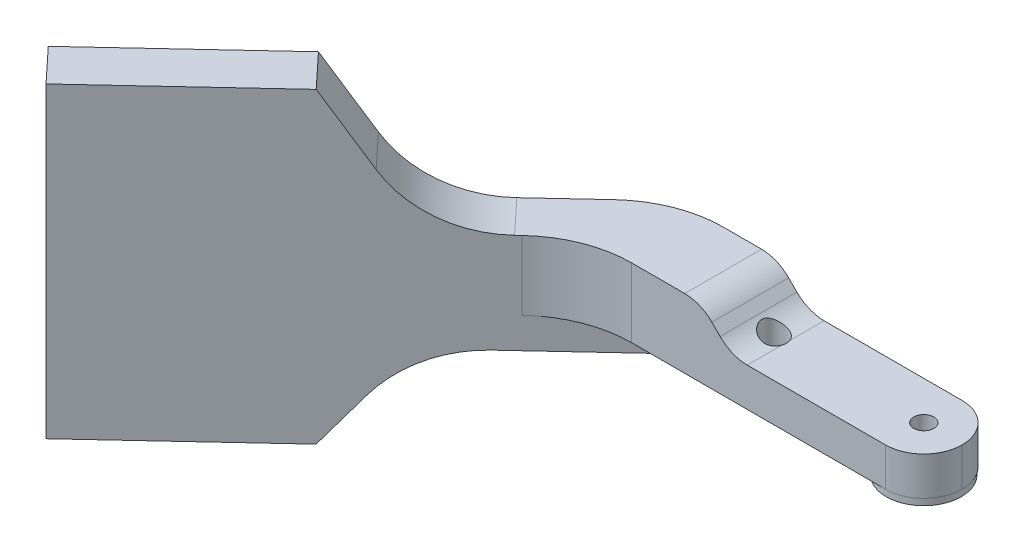
from build123d import *

# Parameters (mm, degrees)
BOSS_EXTRUDE1_DEPTH = 5
FILLET1_R           = 5
SKETCH2_R           = 1.2999999999999945
CUT_EXTRUDE1_DEPTH  = 10
BOSS_EXTRUDE2_DEPTH = 20
BOSS_EXTRUDE3_DEPTH = 15
BOSS_EXTRUDE4_DEPTH = 6
SKETCH6_R           = 4.900000000000002
SKETCH6_R_2         = 1.299999999999994
BOSS_EXTRUDE5_DEPTH = 0.9
BOSS_EXTRUDE6_DEPTH = 3.9999999999999964
BOSS_EXTRUDE7_DEPTH = 3.9999999999999964
FILLET2_R           = 15
FILLET7_SIZE        = 5
FILLET8_R           = 5
SKETCH10_R          = 1.6000000000000019
CUT_EXTRUDE2_DEPTH  = 10


# Some blends are built 0.0001 mm under size
with BuildPart() as part:
    # Sketch1 → Boss-Extrude1 (new body)
    with BuildSketch(Plane(origin=(0, 0, 0), x_dir=(1, 0, 0), z_dir=(0, 1, 0))):
        Polygon((4.091990160374978, 5.611877790284978), (0, 10), (0, 1.79603523340848), align=None)
        Polygon((0, 1.79603523340848), (0, 10), (-42.4185146939121, -29.55590488362469), (-38.32652453353713, -33.94402709333974), (-1.9260119864091507, 0), align=None)
        Polygon((42, 10), (0, 10), (4.091990160374978, 5.611877790284978), (0, 1.7960352334084817), (0, 0), (42, 0), align=None)
        Polygon((0, 0), (0, 1.79603523340848), (-1.9260119864091507, 0), align=None)
    extrude(amount=BOSS_EXTRUDE1_DEPTH)

    # Fillet1
    fillet1_edges = [part.edges().sort_by_distance(p)[0] for p in [
        (42, 2.5, 0),
        (42, 2.5, -10),
    ]]
    fillet(fillet1_edges, radius=FILLET1_R - 0.0001)  # a hair under: the kernel refuses the full size

    # Sketch2 → Cut-Extrude1 (cut)
    with BuildSketch(Plane(origin=(0, 5, 0), x_dir=(1, 0, 0), z_dir=(0, 1, 0))):
        with Locations(Location((37.00000000000001, 4.999999999999989, 0), (0, 0, 270))):
            Circle(SKETCH2_R)
    extrude(amount=-CUT_EXTRUDE1_DEPTH, mode=Mode.SUBTRACT)

    # Sketch3 → Boss-Extrude2 (add)
    with BuildSketch(Plane(origin=(0, 5, 0), x_dir=(1, 0, 0), z_dir=(0, 1, 0))):
        Polygon((-42.4185146939121, -29.55590488362471), (-38.32652453353713, -33.94402709333974), (-20.126268259973138, -16.97201354666987), (-24.21825842034811, -12.583891336954824), align=None)
    extrude(amount=BOSS_EXTRUDE2_DEPTH)

    # Sketch4 → Boss-Extrude3 (add)
    with BuildSketch(Plane.XZ):
        Polygon((-42.4185146939121, 29.55590488362471), (-38.32652453353713, 33.94402709333974), (-20.126268259973134, 16.972013546669885), (-24.218258420348107, 12.583891336954828), align=None)
    extrude(amount=BOSS_EXTRUDE3_DEPTH)

    # Sketch5 → Boss-Extrude4 (add)
    with BuildSketch(Plane(origin=(-4.987820251299118, 0, -5.348782368720677), x_dir=(-0.7313537016191739, 0, 0.6819983600624947), z_dir=(-0.6819983600624948, 0, -0.731353701619174))):
        Polygon((26.29430619749914, -15), (26.29430619749914, 0), (13.888976828400956, 0), align=None)
        Polygon((13.888976828400958, 5), (26.29430619749914, 25), (26.29430619749914, 5), align=None)
    extrude(amount=-BOSS_EXTRUDE4_DEPTH)

    # Sketch6 → Boss-Extrude5 (add)
    with BuildSketch(Plane.XZ):
        with Locations(Location((37.00000000000001, -4.999999999999989, 0), (0, 0, 90))):
            Circle(SKETCH6_R)
        with Locations(Location((37.00000000000001, -4.999999999999989, 0), (0, 0, 90))):
            Circle(SKETCH6_R_2, mode=Mode.SUBTRACT)
    extrude(amount=BOSS_EXTRUDE5_DEPTH)

    # Sketch8 → Boss-Extrude6 (add)
    with BuildSketch(Plane.XZ):
        Polygon((0, -10), (-19.681916643400598, 8.353684194074795), (-15.589926483025625, 12.741806403789838), (8.797675113837775, -10), align=None)
    extrude(amount=BOSS_EXTRUDE6_DEPTH)

    # Sketch9 → Boss-Extrude7 (add)
    with BuildSketch(Plane(origin=(0, 5, 0), x_dir=(1, 0, 0), z_dir=(0, 1, 0))):
        Polygon((0, 10), (-20.891607783919927, -9.48173943217613), (-16.79961762354496, -13.869861641891177), (-1.92601198640914, -7.11e-15), (17.950520425486616, 5.22e-15), (17.950520425486616, 10), align=None)
    extrude(amount=BOSS_EXTRUDE7_DEPTH)

    # Fillet2
    fillet2_edges = [part.edges().sort_by_distance(p)[0] for p in [
        (-14.914116497044613, 8.999999999999996, 8.009621013204299),
        (-1.9260119864091478, 4.499999999999998, 2.06e-15),
        (0, 2.5, -10),
        (-15.518962067304274, -3.9999999999999973, 8.573648632254974),
    ]]
    fillet(fillet2_edges, radius=FILLET2_R)

    # Fillet7
    # the kernel refuses this chamfer: 5 mm, written as the material it takes off along each edge
    with BuildSketch(Plane(origin=(17.950520425486616, 8.999999999999996, 12.858414939829549), x_dir=(0.027495876610586317, -0.9996219169112968, 0), z_dir=(0, 0, -1))) as fillet7_piece_1_section:
        Polygon((FILLET7_SIZE * 0.999621916911, FILLET7_SIZE * 0.0274958766106), (-FILLET7_SIZE * 0.0274958766106, FILLET7_SIZE * 0.999621916911), (0, 0), align=None)
    fillet7_piece_1 = extrude(amount=35.71682987965911, mode=Mode.PRIVATE)
    fillet7_piece_1 = split(fillet7_piece_1, bisect_by=Plane(origin=(16.221928363932022, 5, -5.000000000000004), z_dir=(0, 1, 0)), keep=Keep.TOP, mode=Mode.PRIVATE)
    add(fillet7_piece_1, mode=Mode.SUBTRACT)

    # Fillet8
    fillet8_edges = [part.edges().sort_by_distance(p)[0] for p in [
        (12.95052042548848, 8.999999999998002, -5.000000000000002),
        (16.950520425489678, 5, -4.999999999999999),
    ]]
    fillet(fillet8_edges, radius=FILLET8_R)

    # Sketch10 → Cut-Extrude2 (cut)
    with BuildSketch(Plane(origin=(0, 0, 0), x_dir=(-1, 0, 0), z_dir=(0, -1, 0))):
        with Locations(Location((-17.499999999999247, 5.000000000001407, 0), (0, 0, 90))):
            Circle(SKETCH10_R)
    extrude(amount=-CUT_EXTRUDE2_DEPTH, mode=Mode.SUBTRACT)


solid = part.part
